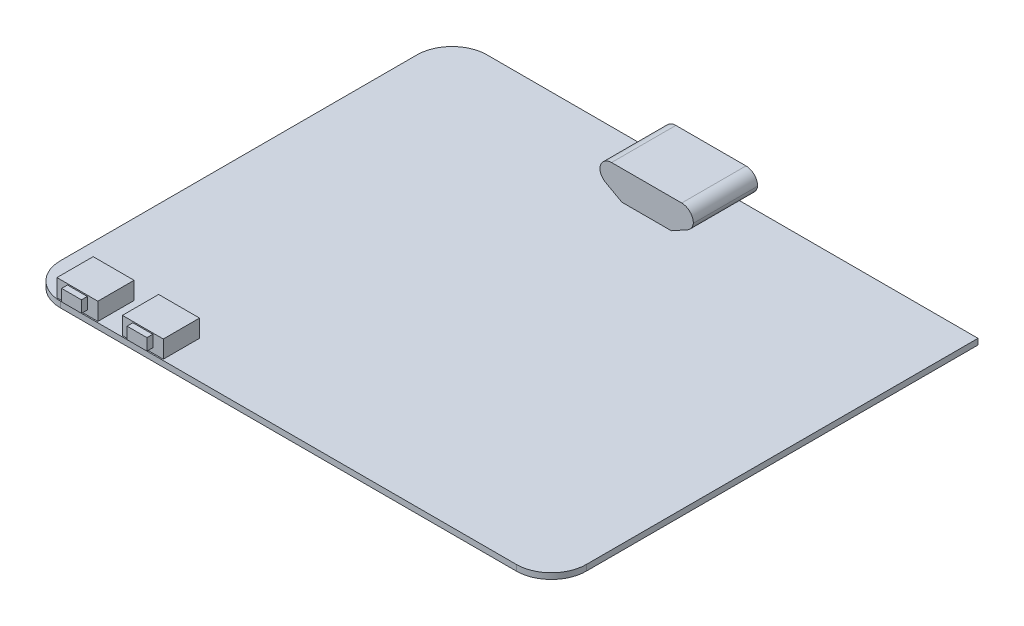
from build123d import *

# Parameters (mm, degrees)
SKETCH_1_W          = 45
SKETCH_1_H          = 36.5
EXTRUDE_1_DEPTH     = 0.5
FILLET_1_R          = 3
SKETCH_2_W          = 5.8
SKETCH_2_H          = 3
EXTRUDE_2_DEPTH     = 1.1
SKETCH_3_R          = 0.65
SKETCH_3_R_2        = 0.47
CUT_EXTRUDE_1_DEPTH = 0.9
FILLET_2_R          = 0.1
SKETCH_4_W          = 3
SKETCH_4_H          = 3
EXTRUDE_3_DEPTH     = 0.5
SKETCH_5_W          = 8
SKETCH_5_H          = 5.5
EXTRUDE_4_DEPTH     = 2.5
FILLET_3_R          = 1
CUT_EXTRUDE_2_DEPTH = 39.704941545
FILLET_4_R          = 1
CUT_EXTRUDE_3_DEPTH = 4.5
SKETCH_9_W          = 3.5
SKETCH_9_H          = 3.1
EXTRUDE_5_DEPTH     = 1.5
SKETCH_10_W         = 1.7
SKETCH_10_H         = 1
EXTRUDE_6_DEPTH     = 0.5


with BuildPart() as part:
    # Эскиз1 → Бобышка-Вытянуть1 (new body)
    with BuildSketch(Plane(origin=(0, 0, 0), x_dir=(1, 0, 0), z_dir=(0, 1, 0))):
        Rectangle(SKETCH_1_W, SKETCH_1_H)
    extrude(amount=EXTRUDE_1_DEPTH)

    # Скругление1
    fillet_1_edges = [part.edges().sort_by_distance(p)[0] for p in [
        (22.5, 0.25, 18.25),
        (-22.5, 0.25, 18.25),
        (-22.5, 0.25, -18.25),
    ]]
    fillet(fillet_1_edges, radius=FILLET_1_R)

    # Эскиз2 → Бобышка-Вытянуть2 (add)
    with BuildSketch(Plane.XZ):
        with Locations((-14.3, 1.45)):
            Rectangle(SKETCH_2_W, SKETCH_2_H)
    extrude(amount=EXTRUDE_2_DEPTH)

    # Эскиз3 → Вырез-Вытянуть1 (cut)
    with BuildSketch(Plane.XZ.offset(1.1)):
        with Locations(Location((-16.2, 1.45, 0), (0, 0, 270))):
            Circle(SKETCH_3_R)
        with Locations(Location((-12.2, 1.45, 0), (0, 0, 270))):
            Circle(SKETCH_3_R_2)
        with BuildLine():
            Line((-13.66, 2.55), (-13.26, 2.55))
            ThreePointArc((-13.26, 2.55), (-13.118578644, 2.491421356), (-13.06, 2.35))
            Line((-13.06, 2.35), (-13.06, 0.55))
            ThreePointArc((-13.06, 0.55), (-13.118578644, 0.408578644), (-13.26, 0.35))
            Line((-13.26, 0.35), (-13.66, 0.35))
            ThreePointArc((-13.66, 0.35), (-13.801421356, 0.408578644), (-13.86, 0.55))
            Line((-13.86, 0.55), (-13.86, 2.35))
            ThreePointArc((-13.86, 2.35), (-13.801421356, 2.491421356), (-13.66, 2.55))
        make_face()
    extrude(amount=-CUT_EXTRUDE_1_DEPTH, mode=Mode.SUBTRACT)

    # Скругление2
    fillet_2_edges = [part.edges().sort_by_distance(p)[0] for p in [
        (-13.801421356, -0.2, 0.408578644),
        (-13.86, -0.2, 1.45),
        (-13.801421356, -0.2, 2.491421356),
        (-13.46, -0.2, 2.55),
        (-13.118578644, -0.2, 2.491421356),
        (-13.06, -0.2, 1.45),
        (-13.118578644, -0.2, 0.408578644),
        (-13.46, -0.2, 0.35),
    ]]
    fillet(fillet_2_edges, radius=FILLET_2_R)

    # Эскиз4 → Бобышка-Вытянуть3 (add)
    with BuildSketch(Plane.XZ):
        with Locations((-14, -6.25)):
            Rectangle(SKETCH_4_W, SKETCH_4_H)
    extrude(amount=EXTRUDE_3_DEPTH)

    # Эскиз5 → Бобышка-Вытянуть4 (add)
    with BuildSketch(Plane(origin=(0, 0.5, 0), x_dir=(1, 0, 0), z_dir=(0, 1, 0))):
        with Locations((-0.7, 15.85)):
            Rectangle(SKETCH_5_W, SKETCH_5_H)
    extrude(amount=EXTRUDE_4_DEPTH)

    # Скругление3
    fillet_3_edges = [part.edges().sort_by_distance(p)[0] for p in [
        (3.3, 3, -15.85),
        (-4.7, 3, -15.85),
    ]]
    fillet(fillet_3_edges, radius=FILLET_3_R)

    # Эскиз6 → Вырез-Вытянуть2 (cut, through all)
    with BuildSketch(Plane.XY.offset(-13.1)):
        Polygon((-4.7, 0.5), (-2.816810686, 0.5), (-4.7, 1.540058106), align=None)
        Polygon((3.3, 1.540058106), (1.416810686, 0.5), (3.3, 0.5), align=None)
    extrude(amount=-CUT_EXTRUDE_2_DEPTH, mode=Mode.SUBTRACT)

    # Скругление4
    # the kernel refuses this fillet: 1 mm, written as the material it takes off along each edge
    with BuildSketch(Plane(origin=(3.3, 1.540058106, -11.651007536), x_dir=(-0.8753697639222053, -0.48345400651021836, 0), z_dir=(0, 0, -1))) as fillet_4_piece_1:
        with BuildLine():
            CenterArc((0.579596986, 1), FILLET_4_R, 216.682538738, 53.317461262)
            Line((-0.222360751, 0.402619227), (-0.238399906, 0.390671612))
            ThreePointArc((-0.238399906, 0.390671612), (-0.128687771, 0.191640533), (-0.017507395, -0.00966908))
            Line((-0.017507395, -0.00966908), (0, -0.02))
            Line((0, -0.02), (0.579596986, -0.02))
            Line((0.579596986, -0.02), (0.579596986, 0))
        make_face()
    extrude(amount=8.397984929, mode=Mode.SUBTRACT)
    with BuildSketch(Plane(origin=(-4.7, 1.540058106, -11.651007536), x_dir=(0, 1, 0), z_dir=(0, 0, -1))) as fillet_4_piece_2:
        with BuildLine():
            CenterArc((0.595161279, 0.990815683), FILLET_4_R, 208.911232689, 53.317461262)
            Line((-0.280208485, 0.507361677), (-0.29771588, 0.497692596))
            Line((-0.29771588, 0.497692596), (-0.017507395, -0.00966908))
            Line((-0.017507395, -0.00966908), (0, -0.02))
            ThreePointArc((0, -0.02), (0.229970947, -0.02), (0.457237506, -0.019816314))
            Line((0.457237506, -0.019816314), (0.459941894, 0))
        make_face()
    extrude(amount=8.397984929, mode=Mode.SUBTRACT)

    # Эскиз8 → Вырез-Вытянуть3 (cut)
    with BuildSketch(Plane(origin=(0, 0, -18.6), x_dir=(-1, 0, 0), z_dir=(0, 0, -1))):
        with BuildLine():
            Line((-2.695947522, 1.434923574), (-1.365252427, 0.7))
            Line((-1.365252427, 0.7), (2.765252427, 0.7))
            Line((2.765252427, 0.7), (4.095947522, 1.434923574))
            ThreePointArc((4.095947522, 1.434923574), (4.365171631, 1.677310395), (4.499884525, 2.013592163))
            ThreePointArc((4.499884525, 2.013592163), (4.260859282, 2.57047074), (3.7, 2.8))
            Line((3.7, 2.8), (-2.3, 2.8))
            ThreePointArc((-2.3, 2.8), (-2.860859282, 2.57047074), (-3.099884525, 2.013592163))
            ThreePointArc((-3.099884525, 2.013592163), (-2.965171631, 1.677310395), (-2.695947522, 1.434923574))
        make_face()
    extrude(amount=-CUT_EXTRUDE_3_DEPTH, mode=Mode.SUBTRACT)

    # Эскиз9 → Бобышка-Вытянуть5 (add)
    with BuildSketch(Plane(origin=(0, 0.5, 0), x_dir=(1, 0, 0), z_dir=(0, 1, 0))):
        with Locations((-18.15, -16.6)):
            Rectangle(SKETCH_9_W, SKETCH_9_H)
        with Locations((-12.55, -16.6)):
            Rectangle(SKETCH_9_W, SKETCH_9_H)
    extrude(amount=EXTRUDE_5_DEPTH)

    # Эскиз10 → Бобышка-Вытянуть6 (add)
    with BuildSketch(Plane.XY.offset(18.15)):
        with Locations((-18.15, 1.4)):
            Rectangle(SKETCH_10_W, SKETCH_10_H)
        with Locations((-12.55, 1.4)):
            Rectangle(SKETCH_10_W, SKETCH_10_H)
    extrude(amount=EXTRUDE_6_DEPTH)


solid = part.part
